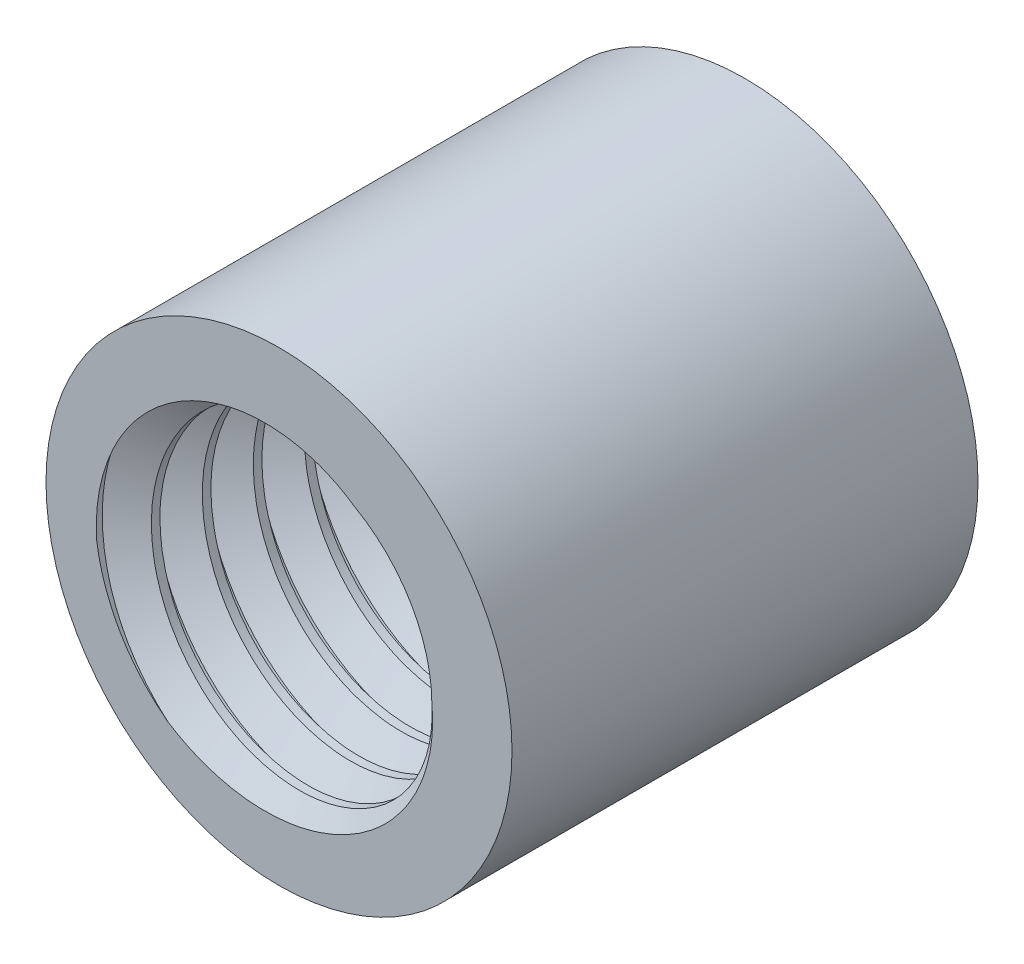
from build123d import *

# Parameters (mm, degrees)
ESQUISSE1_R                           = 8
ESQUISSE1_R_2                         = 5.25
BOSS_EXTRU_1_DEPTH                    = 16
ENL_VEMENT_DE_MATI_RE_BALAYAGE1_PITCH = 1.75


with BuildPart() as part:
    # Esquisse1 → Boss.-Extru.1 (new body)
    with BuildSketch(Plane.XY):
        Circle(ESQUISSE1_R)
        Circle(ESQUISSE1_R_2, mode=Mode.SUBTRACT)
    extrude(amount=BOSS_EXTRU_1_DEPTH)

    # Enlèvement de matière-Balayage1: the profile of Esquisse3 profile screwed along a right-hand helix of 20 turns, 10 arcs to a turn; built about Z, then put on its axis
    enl_vement_de_mati_re_balayage1_z = Axis((0, 0, 0), (0, 0, 1))
    enl_vement_de_mati_re_balayage1_corners = [(5.2497, 0, 0.000173205), (5.2497, 0, -1.455702781), (6.32, 0, -0.837764788), (6.32, 0, -0.617764788)]
    with BuildLine(mode=Mode.PRIVATE) as enl_vement_de_mati_re_balayage1_profile:
        Line(enl_vement_de_mati_re_balayage1_corners[0], enl_vement_de_mati_re_balayage1_corners[1])
        Line(enl_vement_de_mati_re_balayage1_corners[1], enl_vement_de_mati_re_balayage1_corners[2])
        Line(enl_vement_de_mati_re_balayage1_corners[2], enl_vement_de_mati_re_balayage1_corners[3])
        Line(enl_vement_de_mati_re_balayage1_corners[3], enl_vement_de_mati_re_balayage1_corners[0])
    enl_vement_de_mati_re_balayage1_cap = Face(enl_vement_de_mati_re_balayage1_profile.wire())
    enl_vement_de_mati_re_balayage1_turn_angles = [0, 18, 36, 54, 72, 90, 108, 126, 144, 162, 180, 198, 216, 234, 252, 270, 288, 306, 324, 342, 360]
    enl_vement_de_mati_re_balayage1_turn_weights = [1, 0.9510565162951535, 1, 0.9510565162951535, 1, 0.9510565162951535, 1, 0.9510565162951535, 1, 0.9510565162951535, 1, 0.9510565162951535, 1, 0.9510565162951535, 1, 0.9510565162951535, 1, 0.9510565162951535, 1, 0.9510565162951535, 1]
    enl_vement_de_mati_re_balayage1_turn_rails = [Edge.make_bspline([Vector(p[0], p[1], 0).rotate(enl_vement_de_mati_re_balayage1_z, enl_vement_de_mati_re_balayage1_turn_angles[k]) / enl_vement_de_mati_re_balayage1_turn_weights[k] + Vector(0, 0, p[2] + ENL_VEMENT_DE_MATI_RE_BALAYAGE1_PITCH * enl_vement_de_mati_re_balayage1_turn_angles[k] / 360) for k in range(21)], [0, 0, 0, 1, 1, 2, 2, 3, 3, 4, 4, 5, 5, 6, 6, 7, 7, 8, 8, 9, 9, 10, 10, 10], 2, enl_vement_de_mati_re_balayage1_turn_weights) for p in enl_vement_de_mati_re_balayage1_corners]
    enl_vement_de_mati_re_balayage1_turn_sides = [Face.make_surface_from_curves(enl_vement_de_mati_re_balayage1_turn_rails[p[0]], enl_vement_de_mati_re_balayage1_turn_rails[p[1]]) for p in [(0, 1), (1, 2), (2, 3), (3, 0)]]
    enl_vement_de_mati_re_balayage1 = Plane(origin=(0, 0, 16), x_dir=(1, 0, 0), z_dir=(0, 0, -1)) * Solid(Shell([*[p.moved(Location((0, 0, ENL_VEMENT_DE_MATI_RE_BALAYAGE1_PITCH * i))) for i in range(20) for p in enl_vement_de_mati_re_balayage1_turn_sides], enl_vement_de_mati_re_balayage1_cap, enl_vement_de_mati_re_balayage1_cap.rotate(enl_vement_de_mati_re_balayage1_z, 7200).moved(Location((0, 0, ENL_VEMENT_DE_MATI_RE_BALAYAGE1_PITCH * 7200 / 360)))]))
    add(enl_vement_de_mati_re_balayage1, mode=Mode.SUBTRACT)


solid = part.part
